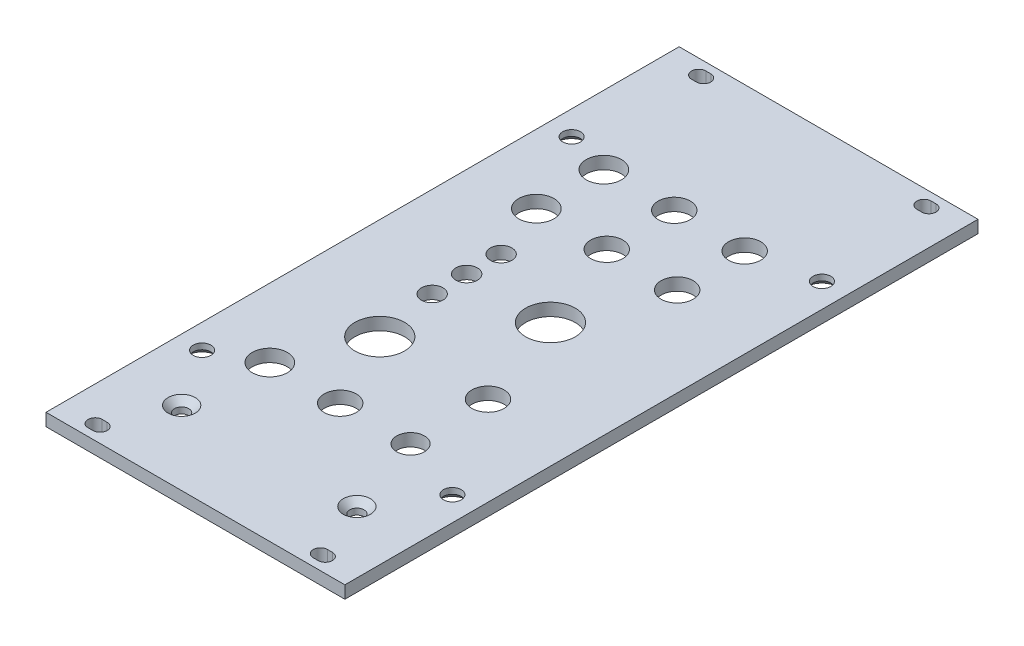
from build123d import *

# Parameters (mm, degrees)
SKETCH1_W                                      = 60.6552
SKETCH1_H                                      = 128.4986
BOSS_EXTRUDE1_DEPTH                            = 2.54
CSK_FOR_M3_FLAT_HEAD_MACHINE_SCREW1_AT_2_COUNT = 2
CSK_FOR_M3_FLAT_HEAD_MACHINE_SCREW1_AT_2_PITCH = 75.0062
M2_5_CLEARANCE_SLOT1_DEPTH                     = 2.54
F_1_4_CLEARANCE_HOLE1_D                        = 7.14248
F_1_4_CLEARANCE_HOLE2_D                        = 6.5278
F_3_8_CLEARANCE_HOLE2_D                        = 10.0838
F_10_CLEARANCE_HOLE1_D                         = 5.6134
CSK_FOR_M2_5_FLAT_HEAD_MACHINE_SCREW1_AT_COUNT = 2
CSK_FOR_M2_5_FLAT_HEAD_MACHINE_SCREW1_AT_PITCH = 35.56
F_11_64_0_17188_DIAMETER_HOLE1_D               = 4.365752


# Read off the part's stored shape, not the designer's step: M2.5 Clearance Slot1
with BuildPart() as part:
    # Sketch1 → Boss-Extrude1 (new body)
    with BuildSketch(Plane(origin=(0, 0, 0), x_dir=(1, 0, 0), z_dir=(0, 1, 0))):
        Rectangle(SKETCH1_W, SKETCH1_H)
    extrude(amount=BOSS_EXTRUDE1_DEPTH)

    # Sketch5 → CSK for M3 Flat Head Machine Screw1 (revolve, cut)
    with BuildSketch(Plane(origin=(25.4, 0, -37.5031), x_dir=(0, 0, -1), z_dir=(1, 0, 0))):
        Polygon((0, 0), (0, 2.54), (1.8, 2.54), (1.8, 1.35), (3.15, 0), align=None)
    csk_for_m3_flat_head_machine_screw1 = revolve(axis=Axis((25.4, -6.35, -37.5031), (0, 1, 0)), mode=Mode.SUBTRACT)

    # CSK for M3 Flat Head Machine Screw1 at 2: CSK for M3 Flat Head Machine Screw1 ×2
    with Locations(*[(0, 0, i * CSK_FOR_M3_FLAT_HEAD_MACHINE_SCREW1_AT_2_PITCH) for i in range(1, CSK_FOR_M3_FLAT_HEAD_MACHINE_SCREW1_AT_2_COUNT)]):
        add(csk_for_m3_flat_head_machine_screw1, mode=Mode.SUBTRACT)

    # M2.5 Clearance Slot1 outline → M2.5 Clearance Slot1 (cut)
    with BuildSketch(Plane(origin=(0, 0, 0), x_dir=(1, 0, 0), z_dir=(0, 1, 0))):
        with BuildLine():
            ThreePointArc((23.36, -62.7021), (24.81, -61.2521), (23.36, -59.8021))
            Line((23.36, -59.8021), (22.36, -59.8021))
            ThreePointArc((22.36, -59.8021), (20.91, -61.2521), (22.36, -62.7021))
            Line((22.36, -62.7021), (23.36, -62.7021))
        make_face()
        with BuildLine():
            ThreePointArc((23.36, 59.8021), (24.81, 61.2521), (23.36, 62.7021))
            Line((23.36, 62.7021), (22.36, 62.7021))
            ThreePointArc((22.36, 62.7021), (20.91, 61.2521), (22.36, 59.8021))
            Line((22.36, 59.8021), (23.36, 59.8021))
        make_face()
    m2_5_clearance_slot1 = extrude(amount=M2_5_CLEARANCE_SLOT1_DEPTH, mode=Mode.SUBTRACT)

    # Mirror1: CSK for M3 Flat Head Machine Screw1, M2.5 Clearance Slot1 across plane
    add(csk_for_m3_flat_head_machine_screw1.mirror(Plane(origin=(0, 0, 0), x_dir=(0, 0, 1), z_dir=(1, 0, 0))), mode=Mode.SUBTRACT)
    add(m2_5_clearance_slot1.mirror(Plane(origin=(0, 0, 0), x_dir=(0, 0, 1), z_dir=(1, 0, 0))), mode=Mode.SUBTRACT)

    # Mirror1 copy 1 sketch → Mirror1 copy 1 (revolve, cut)
    with BuildSketch(Plane(origin=(-25.4, 0, 37.5031), x_dir=(0, 0, -1), z_dir=(-1, 0, 0))):
        Polygon((0, 0), (0, -2.54), (1.8, -2.54), (1.8, -1.35), (3.15, 0), align=None)
    revolve(axis=Axis((-25.4, -6.35, 37.5031), (0, -1, 0)), mode=Mode.SUBTRACT)

    # 1/4 Clearance Hole1 (through all)
    with Locations(Plane(origin=(0, 0, 0), x_dir=(-1, 0, 0), z_dir=(0, -1, 0))):
        with Locations((16.3576, 35.0012), (16.3576, 21.301199968), (16.3576, -32.798800036)):
            Hole(F_1_4_CLEARANCE_HOLE1_D / 2)

    # 1/4 Clearance Hole2 (through all)
    with Locations(Plane(origin=(0, 0, 0), x_dir=(-1, 0, 0), z_dir=(0, -1, 0))):
        with Locations((-12.2174, 35.0012), (2.0701, 35.0012), (2.0701, 21.301199968), (-12.2174, 21.301199968), (-12.2174, -17.08879996), (2.0701, -32.798800036)):
            Hole(F_1_4_CLEARANCE_HOLE2_D / 2)

    # 3/8 Clearance Hole2 (through all)
    with Locations(Plane(origin=(0, 0, 0), x_dir=(-1, 0, 0), z_dir=(0, -1, 0))):
        with Locations((9.7536, -17.08879996), (-5.07365, 2.731200024)):
            Hole(F_3_8_CLEARANCE_HOLE2_D / 2)

    # #10 Clearance Hole1 (through all)
    with Locations(Plane(origin=(0, 0, 0), x_dir=(-1, 0, 0), z_dir=(0, -1, 0))):
        with Locations((-12.2174, -32.798800036)):
            Hole(F_10_CLEARANCE_HOLE1_D / 2)

    # Sketch73 → CSK for M2.5 Flat Head Machine Screw1 (revolve, cut)
    with BuildSketch(Plane(origin=(-17.78, 2.54, 49.2633), x_dir=(0, 0, 1), z_dir=(1, 0, 0))):
        Polygon((0, 0), (0, 2.54), (1.45, 2.54), (1.45, 1.3), (2.75, 0), align=None)
    csk_for_m2_5_flat_head_machine_screw1 = revolve(axis=Axis((-17.78, 8.89, 49.2633), (0, -1, 0)), mode=Mode.SUBTRACT)

    # CSK for M2.5 Flat Head Machine Screw1 at: CSK for M2.5 Flat Head Machine Screw1 ×2
    with Locations(*[(i * CSK_FOR_M2_5_FLAT_HEAD_MACHINE_SCREW1_AT_PITCH, 0, 0) for i in range(1, CSK_FOR_M2_5_FLAT_HEAD_MACHINE_SCREW1_AT_COUNT)]):
        add(csk_for_m2_5_flat_head_machine_screw1, mode=Mode.SUBTRACT)

    # 11/64 (0.17188) Diameter Hole1 (through all)
    with Locations(Plane(origin=(0, 0, 0), x_dir=(-1, 0, 0), z_dir=(0, -1, 0))):
        with Locations((11.938, 9.731199994), (11.938, 2.731200024), (11.938, -4.268799946)):
            Hole(F_11_64_0_17188_DIAMETER_HOLE1_D / 2)


solid = part.part
